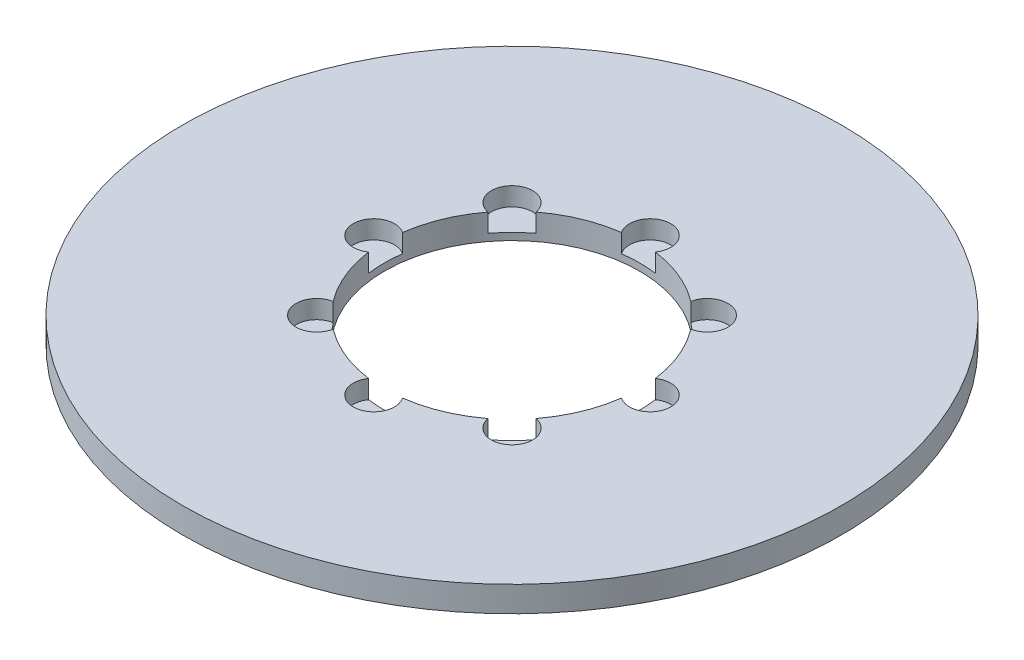
from build123d import *

# Parameters (mm, degrees)
SKETCH1_R           = 77.5
BOSS_EXTRUDE1_DEPTH = 6
SKETCH2_R           = 30
CUT_EXTRUDE1_DEPTH  = 110.765659475
SKETCH3_R           = 4.844319101
CUT_EXTRUDE2_DEPTH  = 4.325646513
CIRPATTERN1_COUNT   = 8


with BuildPart() as part:
    # Sketch1 → Boss-Extrude1 (new body)
    with BuildSketch(Plane(origin=(0, 0, 0), x_dir=(1, 0, 0), z_dir=(0, 1, 0))):
        Circle(SKETCH1_R)
    extrude(amount=BOSS_EXTRUDE1_DEPTH)

    # Sketch2 → Cut-Extrude1 (cut, through all)
    with BuildSketch(Plane(origin=(0, 0, 0), x_dir=(1, 0, 0), z_dir=(0, 1, 0))):
        Circle(SKETCH2_R)
    extrude(amount=CUT_EXTRUDE1_DEPTH, mode=Mode.SUBTRACT)

    # Sketch3 → Cut-Extrude2 (cut)
    with BuildSketch(Plane(origin=(0, 6, 0), x_dir=(1, 0, 0), z_dir=(0, 1, 0))):
        with Locations((-32.484367681, 0)):
            Circle(SKETCH3_R)
    cut_extrude2 = extrude(amount=-CUT_EXTRUDE2_DEPTH, mode=Mode.SUBTRACT)

    # CirPattern1: Cut-Extrude2 ×8 about axis
    cirpattern1_axis = Axis((0, 0, 0), (0, 1, 0))
    for i in range(1, CIRPATTERN1_COUNT):
        add(cut_extrude2.rotate(cirpattern1_axis, i * 360 / CIRPATTERN1_COUNT), mode=Mode.SUBTRACT)


solid = part.part
